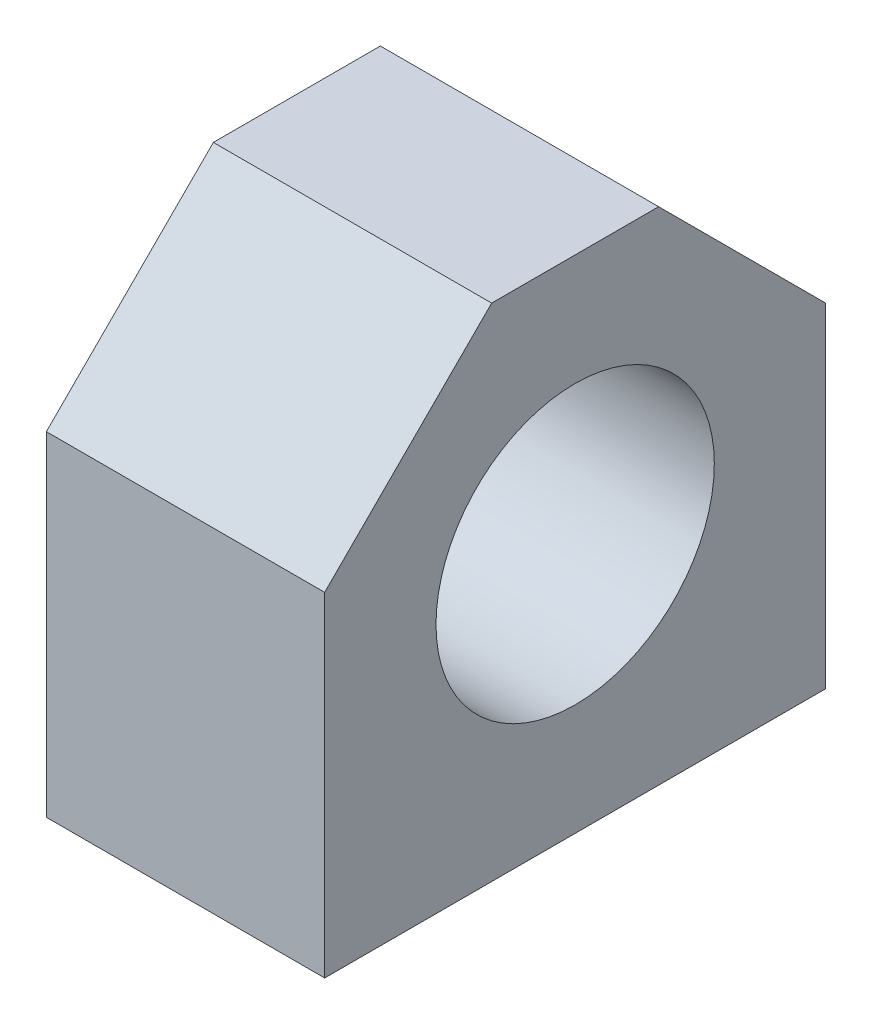
from build123d import *

# Parameters (mm, degrees)
SKETCH2_W           = 57.15
SKETCH2_H           = 57.15
BOSS_EXTRUDE2_DEPTH = 31.75
SKETCH3_R           = 15.875
CUT_EXTRUDE1_DEPTH  = 87.834944003
CUT_EXTRUDE2_DEPTH  = 2.54
FILLET1_R           = 3.175
CHAMFER1_SIZE       = 19.05


with BuildPart() as part:
    # Sketch2 → Boss-Extrude2 (new body)
    with BuildSketch(Plane(origin=(0, 0, 0), x_dir=(0, 0, -1), z_dir=(1, 0, 0))):
        with Locations((28.575, 28.575)):
            Rectangle(SKETCH2_W, SKETCH2_H)
    extrude(amount=BOSS_EXTRUDE2_DEPTH)

    # Sketch3 → Cut-Extrude1 (cut, through all)
    with BuildSketch(Plane(origin=(31.75, 0, 0), x_dir=(0, 0, -1), z_dir=(1, 0, 0))):
        with Locations((28.575, 28.575)):
            Circle(SKETCH3_R)
    extrude(amount=-CUT_EXTRUDE1_DEPTH, mode=Mode.SUBTRACT)

    # Sketch4 → Cut-Extrude2 (cut)
    with BuildSketch(Plane.ZY):
        with BuildLine():
            Line((-36.188382543, 46.0375), (-20.961617457, 46.0375))
            ThreePointArc((-20.961617457, 46.0375), (-9.525, 28.575), (-20.961617457, 11.1125))
            Line((-20.961617457, 11.1125), (-36.188382543, 11.1125))
            ThreePointArc((-36.188382543, 11.1125), (-47.625, 28.575), (-36.188382543, 46.0375))
        make_face()
    extrude(amount=-CUT_EXTRUDE2_DEPTH, mode=Mode.SUBTRACT)

    # Fillet1
    fillet1_edges = [part.edges().sort_by_distance(p)[0] for p in [
        (1.27, 11.1125, -36.188382543),
        (1.27, 11.1125, -20.961617457),
        (1.27, 46.0375, -20.961617457),
        (1.27, 46.0375, -36.188382543),
    ]]
    fillet(fillet1_edges, radius=FILLET1_R)

    # Chamfer1
    chamfer1_edges = [part.edges().sort_by_distance(p)[0] for p in [
        (15.875, 57.15, -57.15),
        (15.875, 57.15, 0),
    ]]
    chamfer(chamfer1_edges, length=CHAMFER1_SIZE)


solid = part.part
